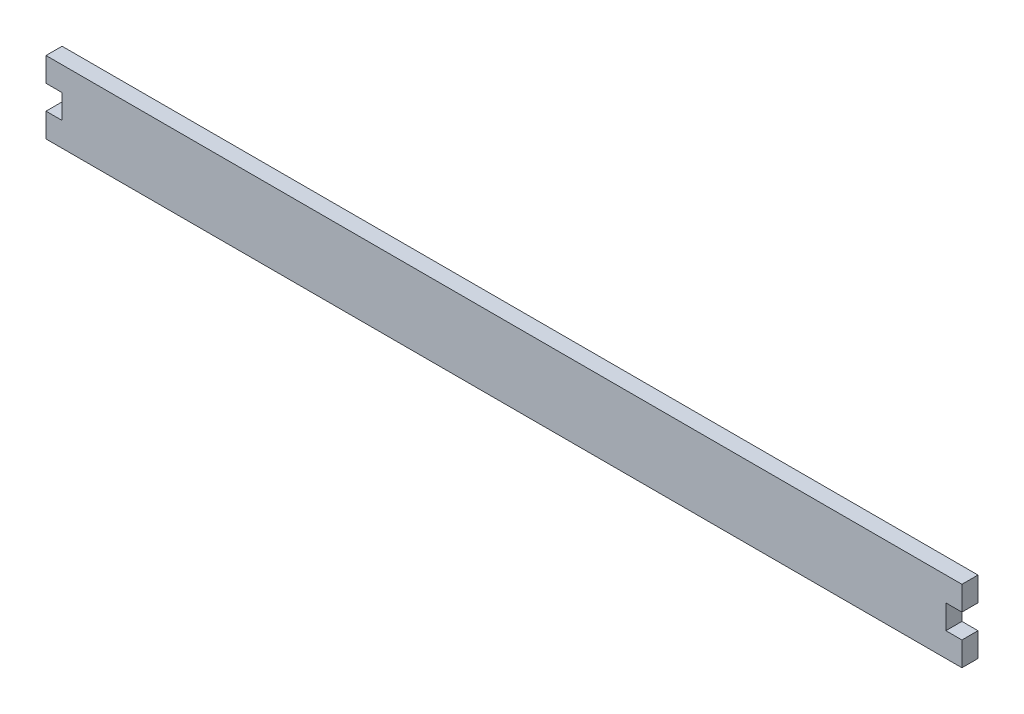
from build123d import *

# Parameters (mm, degrees)
SKETCH1_W             = 570
SKETCH1_H             = 45
EXTRUDE_360_DEPTH     = 10
CUT_EXTRUDE_575_REACH = 288.062
SKETCH2_W             = 10
SKETCH2_H             = 15


with BuildPart() as part:
    # Sketch1 → Extrude 360 (new body)
    with BuildSketch(Plane.XY):
        Rectangle(SKETCH1_W, SKETCH1_H)
    extrude(amount=EXTRUDE_360_DEPTH)

    # Sketch2 → Cut-Extrude 575 (cut, up to next)
    with BuildSketch(Plane.XY.offset(10), mode=Mode.PRIVATE) as cut_extrude_575_sk1:
        with Locations((-280, 0)):
            Rectangle(SKETCH2_W, SKETCH2_H)
    cut_extrude_575_tool1 = extrude(cut_extrude_575_sk1.sketch, amount=-CUT_EXTRUDE_575_REACH, mode=Mode.PRIVATE) & part.part
    cut_extrude_575 = cut_extrude_575_tool1.solids().sort_by_distance((-280, 0, 10))[0]
    add(cut_extrude_575, mode=Mode.SUBTRACT)

    # Mirror1: Cut-Extrude 575 across plane
    add(cut_extrude_575.mirror(Plane(origin=(0, 0, 0), x_dir=(0, 0, 1), z_dir=(1, 0, 0))), mode=Mode.SUBTRACT)


solid = part.part
